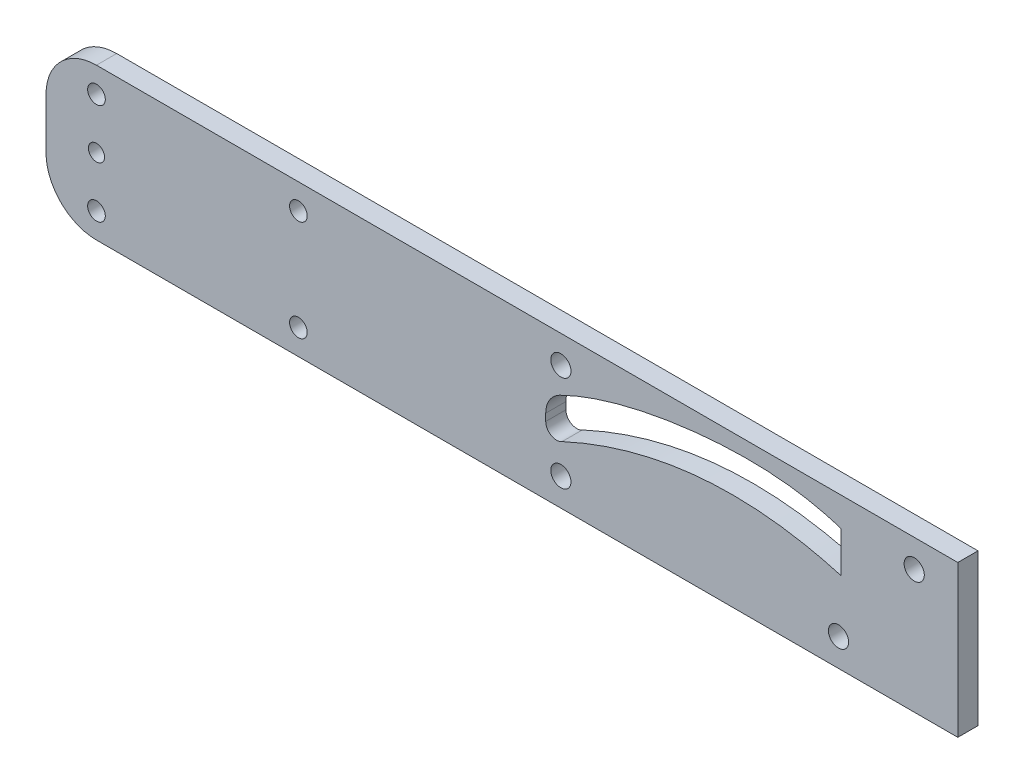
from build123d import *

# Parameters (mm, degrees)
SKETCH_1_W           = 140
SKETCH_1_H           = 40
EXTRUDE_1_DEPTH      = 35
CUT_EXTRUDE_START    = -25
CUT_EXTRUDE_1_DEPTH  = 25
SKETCH_3_W           = 20.946458808
SKETCH_3_H           = 40
CUT_EXTRUDE_2_DEPTH  = 50
SKETCH_4_W           = 119.053541192
SKETCH_4_H           = 40
CUT_EXTRUDE_3_DEPTH  = 16
SKETCH_5_W           = 119.053541192
SKETCH_5_H           = 7.566301572
CUT_EXTRUDE_4_DEPTH  = 33
FILLET_1_R           = 5
SKETCH_6_W           = 119.053541192
SKETCH_6_H           = 32.433698428
EXTRUDE_2_DEPTH      = 3
SKETCH_7_W           = 119.053541192
SKETCH_7_H           = 2.43
CUT_EXTRUDE_5_DEPTH  = 25
FILLET_2_R           = 15
SKETCH_10_W          = 35.667768889
SKETCH_10_H          = 41.429485403
CUT_EXTRUDE_8_DEPTH  = 50
SKETCH_11_W          = 23.137651911
SKETCH_11_H          = 30.003698428
EXTRUDE_3_DEPTH      = 19
SKETCH_12_W          = 18
SKETCH_12_H          = 30.003698428
CUT_EXTRUDE_9_DEPTH  = 150
SKETCH_8_R           = 2
CUT_EXTRUDE_10_DEPTH = 4
SKETCH_13_W          = 4
SKETCH_13_H          = 30.003698428
EXTRUDE_4_DEPTH      = 94
SKETCH_14_R          = 1.6
SKETCH_14_R_2        = 1.75
CUT_EXTRUDE_11_DEPTH = 94
FILLET_4_R           = 10


# Read off the part's stored shape, not the designer's step: 切除-拉伸1
with BuildPart() as part:
    # 草图1 → 凸台-拉伸1 (new body)
    with BuildSketch(Plane.XY):
        Rectangle(SKETCH_1_W, SKETCH_1_H)
    extrude(amount=EXTRUDE_1_DEPTH)

    # 切除-拉伸1 outline → 切除-拉伸1 (cut)
    with BuildSketch(Plane.XY.offset(35).offset(CUT_EXTRUDE_START)):
        with BuildLine():
            ThreePointArc((-65, 0.939701666), (-63.90540849, -0.926084141), (-61.742713718, -0.880933602))
            add(Edge.make_bspline(
                [(-61.742713718, -0.880933602), (-32.663633491, 12.545599653), (-3.21353823, 2.722880029)],
                knots=[0, 0, 0, 1, 1, 1], degree=2))
            add(Edge.make_bspline(
                [(-3.21353823, 2.722880029), (7.778991577, -3.486736981), (19.521763095, -12.075038105), (32.974458778, -10.310789055)],
                knots=[0, 0, 0, 0, 1, 1, 1, 1], degree=3))
            add(Edge.make_bspline(
                [(-1.265226953, 9.621082728), (5.319961167, 7.826511536), (19.072649984, 4.273931772), (30.116773563, 18.680420492), (50.141031873, 7.903163107), (40.152384038, -8.700046956), (32.974458778, -10.310789055)],
                knots=[0, 0, 0, 0, 0.327114299, 0.472643013, 0.672292196, 1, 1, 1, 1], degree=3))
            add(Edge.make_bspline(
                [(-62.225486261, 6.840593766), (-61.950401652, 6.977325912), (-60.645663364, 7.609645854), (-56.787258029, 9.270913685), (-50.206414035, 11.371256832), (-41.494158434, 13.209404155), (-32.600965324, 14.299233241), (-23.90205386, 14.645800276), (-15.41426271, 14.074279585), (-7.837972032, 12.457111584), (-3.215945129, 10.610499943), (-1.265226953, 9.621082728)],
                knots=[0.117371432, 0.117371432, 0.117371432, 0.117371432, 0.12919832, 0.172962492, 0.2758611, 0.378759707, 0.481658315, 0.584556923, 0.687455531, 0.790354139, 0.871867558, 0.871867558, 0.871867558, 0.871867558], degree=3))
            ThreePointArc((-62.225486261, 6.840593766), (-64.250143015, 4.996865242), (-65, 2.363182583))
            Line((-65, 2.363182583), (-65, 0.939701666))
        make_face()
    extrude(amount=CUT_EXTRUDE_1_DEPTH, mode=Mode.SUBTRACT)

    # 草图3 → 切除-拉伸2 (cut)
    with BuildSketch(Plane.XY.offset(35)):
        with Locations((59.526770596, 0)):
            Rectangle(SKETCH_3_W, SKETCH_3_H)
    extrude(amount=-CUT_EXTRUDE_2_DEPTH, mode=Mode.SUBTRACT)

    # 草图4 → 切除-拉伸3 (cut)
    with BuildSketch(Plane(origin=(0, 0, 0), x_dir=(-1, 0, 0), z_dir=(0, 0, -1))):
        with Locations((10.473229404, 0)):
            Rectangle(SKETCH_4_W, SKETCH_4_H)
    extrude(amount=-CUT_EXTRUDE_3_DEPTH, mode=Mode.SUBTRACT)

    # 草图5 → 切除-拉伸4 (cut)
    with BuildSketch(Plane.XY.offset(35)):
        with Locations((-10.473229404, -16.216849214)):
            Rectangle(SKETCH_5_W, SKETCH_5_H)
    extrude(amount=-CUT_EXTRUDE_4_DEPTH, mode=Mode.SUBTRACT)

    # 圆角1
    fillet_1_edges = [part.edges().sort_by_distance(p)[0] for p in [
        (-3.21353823, 2.722880029, 25.5),
        (-1.265226953, 9.621082728, 25.5),
    ]]
    fillet(fillet_1_edges, radius=FILLET_1_R)

    # 草图6 → 凸台-拉伸2 (add)
    with BuildSketch(Plane.XY.offset(35)):
        with Locations((-10.473229404, 3.783150786)):
            Rectangle(SKETCH_6_W, SKETCH_6_H)
    extrude(amount=EXTRUDE_2_DEPTH)

    # 草图7 → 切除-拉伸5 (cut)
    with BuildSketch(Plane(origin=(0, 0, 16), x_dir=(-1, 0, 0), z_dir=(0, 0, -1))):
        with Locations((10.473229404, 18.785)):
            Rectangle(SKETCH_7_W, SKETCH_7_H)
    extrude(amount=-CUT_EXTRUDE_5_DEPTH, mode=Mode.SUBTRACT)

    # 圆角2
    fillet_2_edges = [part.edges().sort_by_distance(p)[0] for p in [
        (49.053541192, 17.57, 27),
        (49.053541192, -12.433698428, 27),
    ]]
    fillet(fillet_2_edges, radius=FILLET_2_R)

    # 草图10 → 切除-拉伸8 (cut)
    with BuildSketch(Plane(origin=(0, 0, 16), x_dir=(-1, 0, 0), z_dir=(0, 0, -1))):
        with Locations((-34.472180194, 2.38587436)):
            Rectangle(SKETCH_10_W, SKETCH_10_H)
    extrude(amount=-CUT_EXTRUDE_8_DEPTH, mode=Mode.SUBTRACT)

    # 草图11 → 凸台-拉伸3 (add)
    with BuildSketch(Plane(origin=(0, 0, 16), x_dir=(-1, 0, 0), z_dir=(0, 0, -1))):
        with Locations((-5.069469793, 2.568150786)):
            Rectangle(SKETCH_11_W, SKETCH_11_H)
    extrude(amount=-EXTRUDE_3_DEPTH)

    # 草图12 → 切除-拉伸9 (cut)
    with BuildSketch(Plane.ZY.offset(70)):
        with Locations((29, 2.568150786)):
            Rectangle(SKETCH_12_W, SKETCH_12_H)
    extrude(amount=-CUT_EXTRUDE_9_DEPTH, mode=Mode.SUBTRACT)

    # 草图8 → 切除-拉伸10 (cut)
    with BuildSketch(Plane(origin=(0, 0, 16), x_dir=(-1, 0, 0), z_dir=(0, 0, -1))):
        with Locations((62, 12.07)):
            Circle(SKETCH_8_R)
        with Locations((-8, 12.07)):
            Circle(SKETCH_8_R)
        with Locations((62, -6.933698428)):
            Circle(SKETCH_8_R)
        with Locations((7, -6.933698428)):
            Circle(SKETCH_8_R)
    extrude(amount=-CUT_EXTRUDE_10_DEPTH, mode=Mode.SUBTRACT)

    # 草图13 → 凸台-拉伸4 (add)
    with BuildSketch(Plane.ZY.offset(70)):
        with Locations((18, 2.568150786)):
            Rectangle(SKETCH_13_W, SKETCH_13_H)
    extrude(amount=EXTRUDE_4_DEPTH)

    # 草图14 → 切除-拉伸11 (cut)
    with BuildSketch(Plane(origin=(0, 0, 16), x_dir=(-1, 0, 0), z_dir=(0, 0, -1))):
        with Locations((154, 2.568150786)):
            Circle(SKETCH_14_R)
        with Locations((114, 12.568150786)):
            Circle(SKETCH_14_R_2)
        with Locations((154, 12.568150786)):
            Circle(SKETCH_14_R_2)
        with Locations((154, -7.431849214)):
            Circle(SKETCH_14_R_2)
        with Locations((114, -7.431849214)):
            Circle(SKETCH_14_R_2)
    extrude(amount=-CUT_EXTRUDE_11_DEPTH, mode=Mode.SUBTRACT)

    # 圆角4
    fillet_4_edges = [part.edges().sort_by_distance(p)[0] for p in [
        (-164, -12.433698428, 18),
        (-164, 17.57, 18),
    ]]
    fillet(fillet_4_edges, radius=FILLET_4_R)


solid = part.part
